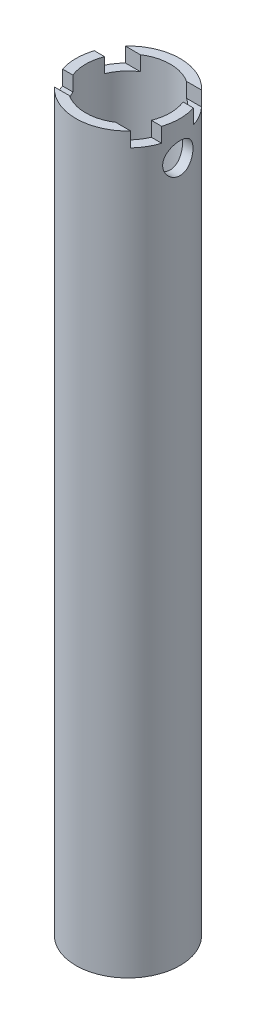
from build123d import *

# Parameters (mm, degrees)
SKETCH_1_R          = 10.65
SKETCH_1_R_2        = 8.65
EXTRUDE_1_DEPTH     = 150
SKETCH_2_R          = 3.1
CUT_EXTRUDE_1_DEPTH = 5
OTHER_START         = -3
OTHER_1_DEPTH       = 3


# Read off the part's stored shape, not the designer's step: Полость1
with BuildPart() as part:
    # Эскиз1 → Бобышка-Вытянуть1 (new body)
    with BuildSketch(Plane(origin=(0, 0, 0), x_dir=(1, 0, 0), z_dir=(0, 1, 0))):
        with Locations(Location((0, 0, 0), (0, 0, 270))):
            Circle(SKETCH_1_R)
        with Locations(Location((0, 0, 0), (0, 0, 270))):
            Circle(SKETCH_1_R_2, mode=Mode.SUBTRACT)
    extrude(amount=-EXTRUDE_1_DEPTH)

    # Эскиз2 → Вырез-Вытянуть1 (cut, symmetric)
    with BuildSketch(Plane(origin=(8.65, 0, 0), x_dir=(0, 0, -1), z_dir=(1, 0, 0))):
        with Locations((0, -7)):
            Circle(SKETCH_2_R)
    extrude(amount=CUT_EXTRUDE_1_DEPTH, both=True, mode=Mode.SUBTRACT)

    # Полость1 outline → Полость1 (cut)
    with BuildSketch(Plane(origin=(0, 0, 0), x_dir=(1, 0, 0), z_dir=(0, 1, 0)).offset(OTHER_START)):
        with BuildLine():
            Line((10.141991915, -3.25), (8.01623353, -3.25))
            ThreePointArc((8.01623353, -3.25), (6.673866727, -5.502908587), (4.718050445, -7.25))
            Line((4.718050445, -7.25), (7.801281946, -7.25))
            ThreePointArc((7.801281946, -7.25), (9.191858855, -5.378868914), (10.141991915, -3.25))
        make_face()
        with BuildLine():
            Line((-7.801281946, -7.25), (-4.718050445, -7.25))
            ThreePointArc((-4.718050445, -7.25), (-6.673866727, -5.502908587), (-8.01623353, -3.25))
            Line((-8.01623353, -3.25), (-10.141991915, -3.25))
            ThreePointArc((-10.141991915, -3.25), (-9.191858855, -5.378868914), (-7.801281946, -7.25))
        make_face()
    other_1 = extrude(amount=OTHER_1_DEPTH, mode=Mode.SUBTRACT)

    # Зеркальное отражение1: Полость1 across plane
    add(other_1.mirror(Plane.XY), mode=Mode.SUBTRACT)


solid = part.part
